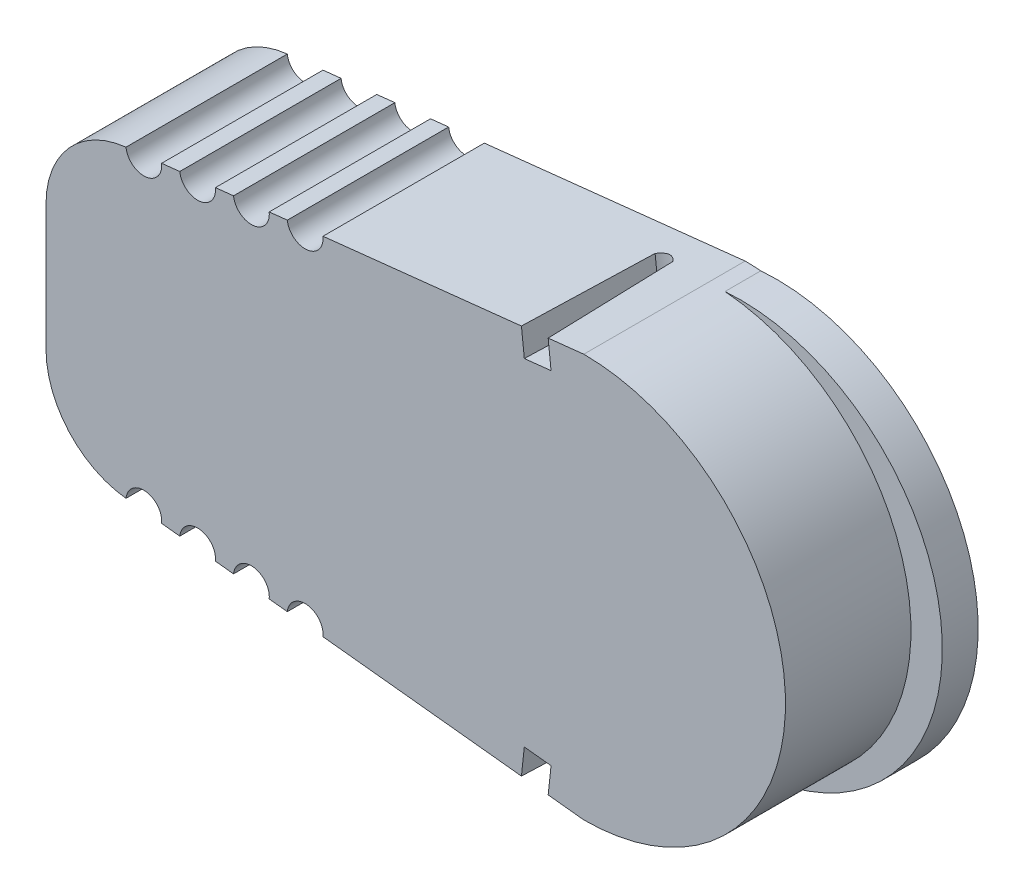
from build123d import *

# Parameters (mm, degrees)
SENSOR_HEIGHT_DEPTH               = 9
SENSOR_LIP_HEIGHT_DEPTH           = 2
SHORT_SIDE_EDGE_ROUNDING_R        = 5
SENSOR_HOLES_R                    = 1
EXTRUDED_SENSOR_HOLES_DEPTH       = 26.880736079
BOTTOM_TRIANGLE_CUT_DEPTH         = 1.5
TOP_TRIANGLE_CUT_DEPTH            = 1.5
FILAMENT_HOLE_CUT_DEPTH           = 2.5
FILAMENT_PROFILE_R                = 0.175
SENSING_START                     = -2
SENSING_FILAMENT_R                = 0.175
SENSING_FILAMENT_R_2              = 0.15
SENSING_PORTION_OF_FILAMENT_DEPTH = 2


# Read off the part's stored shape, not the designer's step: Sensor Lip Height
with BuildPart() as part:
    # Basic Sensor Dimensions → Sensor Height (new body)
    with BuildSketch(Plane.XY):
        with BuildLine():
            Line((-21.5, 8), (-21.5, -8))
            Line((-21.5, -8), (8.5, -11.25))
            ThreePointArc((8.5, -11.25), (19.75, 0), (8.5, 11.25))
            Line((8.5, 11.25), (-21.5, 8))
        make_face()
    extrude(amount=SENSOR_HEIGHT_DEPTH)

    # Sensor Lip Height outline → Sensor Lip Height (add)
    with BuildSketch(Plane.XY):
        with BuildLine():
            ThreePointArc((9.375, -11.215920604), (21.5, 0), (9.375, 11.215920604))
            ThreePointArc((9.375, 11.215920604), (19.75, 0), (9.375, -11.215920604))
        make_face()
    extrude(amount=SENSOR_LIP_HEIGHT_DEPTH)

    # Short Side Edge Rounding
    short_side_edge_rounding_edges = [part.edges().sort_by_distance(p)[0] for p in [
        (-21.5, -8, 4.5),
        (-21.5, 8, 4.5),
    ]]
    fillet(short_side_edge_rounding_edges, radius=SHORT_SIDE_EDGE_ROUNDING_R)

    # Sensor Holes → Extruded Sensor Holes (cut, through all)
    with BuildSketch(Plane.XY.offset(9)):
        with Locations((-16.044332748, -8.591030619)):
            Circle(SENSOR_HOLES_R)
        with Locations((-13.044332748, -8.916030619)):
            Circle(SENSOR_HOLES_R)
        with Locations((-10.044332748, -9.241030619)):
            Circle(SENSOR_HOLES_R)
        with Locations((-7.044332748, -9.566030619)):
            Circle(SENSOR_HOLES_R)
        with Locations((-10.044332748, 9.241030619)):
            Circle(SENSOR_HOLES_R)
        with Locations((-7.044332748, 9.566030619)):
            Circle(SENSOR_HOLES_R)
        with Locations((-13.044332748, 8.916030619)):
            Circle(SENSOR_HOLES_R)
        with Locations((-16.044332748, 8.591030619)):
            Circle(SENSOR_HOLES_R)
    extrude(amount=-EXTRUDED_SENSOR_HOLES_DEPTH, mode=Mode.SUBTRACT)

    # Bottom Triangle → Bottom Triangle Cut (cut)
    with BuildSketch(Plane(origin=(-1.106012767, -10.209348617, 0), x_dir=(0.9941830955390242, -0.10770316868339427, 0), z_dir=(-0.10770316868339427, -0.9941830955390242, 0))):
        with BuildLine():
            Line((6.91221696, 1.5), (6.91221696, 9))
            Line((6.91221696, 9), (6.16221696, 9))
            Line((6.16221696, 9), (6.41221696, 1.790726708))
            add(Edge.make_bspline(
                [(6.41221696, 1.790726708), (6.66221696, 1.5), (6.91221696, 1.5)],
                knots=[0, 0, 0, 0.5, 0.5, 0.5], degree=2))
        make_face()
        with BuildLine():
            Line((7.41221696, 1.790726708), (7.66221696, 9))
            Line((7.66221696, 9), (6.91221696, 9))
            Line((6.91221696, 9), (6.91221696, 1.5))
            add(Edge.make_bspline(
                [(6.91221696, 1.5), (7.16221696, 1.5), (7.41221696, 1.790726708)],
                knots=[0.5, 0.5, 0.5, 1, 1, 1], degree=2))
        make_face()
    extrude(amount=-BOTTOM_TRIANGLE_CUT_DEPTH, mode=Mode.SUBTRACT)

    # Top Triangle → Top Triangle Cut (cut)
    with BuildSketch(Plane(origin=(-1.106012767, 10.209348617, 0), x_dir=(0.9941830955390242, 0.10770316868339432, 0), z_dir=(-0.10770316868339432, 0.9941830955390242, 0))):
        with BuildLine():
            Line((6.91221696, -9), (7.66221696, -9))
            Line((7.66221696, -9), (7.41221696, -1.790726708))
            add(Edge.make_bspline(
                [(6.91221696, -1.5), (7.16221696, -1.5), (7.41221696, -1.790726708)],
                knots=[0.5, 0.5, 0.5, 1, 1, 1], degree=2))
            Line((6.91221696, -1.5), (6.91221696, -9))
        make_face()
        with BuildLine():
            Line((6.16221696, -9), (6.91221696, -9))
            Line((6.91221696, -9), (6.91221696, -1.5))
            add(Edge.make_bspline(
                [(6.41221696, -1.790726708), (6.66221696, -1.5), (6.91221696, -1.5)],
                knots=[0, 0, 0, 0.5, 0.5, 0.5], degree=2))
            Line((6.41221696, -1.790726708), (6.16221696, -9))
        make_face()
    extrude(amount=-TOP_TRIANGLE_CUT_DEPTH, mode=Mode.SUBTRACT)

    # Filament Hole → Filament Hole Cut (cut)
    with BuildSketch(Plane(origin=(0, 0, 0), x_dir=(-1, 0, 0), z_dir=(0, 0, -1))):
        with BuildLine():
            Line((4.5, 1), (1.5, 1))
            Line((1.5, 1), (1.5, -1))
            Line((1.5, -1), (4.5, -1))
            ThreePointArc((4.5, -1), (5.5, 0), (4.5, 1))
        make_face()
    extrude(amount=-FILAMENT_HOLE_CUT_DEPTH, mode=Mode.SUBTRACT)

    # Filament: sweep along a curve in space
    with BuildLine() as filament_path:
        Line((-3.5, 0, 0), (-3.5, 0, 2.5))
        Line((-3.5, 0, 0), (5.692388155, 0, -9.192388155))
    # Filament profile (on start of the path) → Filament (sweep)
    with BuildSketch(Plane(origin=(5.692388155, 0, -9.192388155), x_dir=(0.7071067811865488, 0, 0.7071067811865464), z_dir=(-0.7071067811865464, 0, 0.7071067811865488))):
        Circle(FILAMENT_PROFILE_R)
    sweep(path=filament_path.line, transition=Transition.RIGHT)

    # Sensing Filament → Sensing Portion of Filament (cut)
    with BuildSketch(Plane(origin=(7.442388155, 0, -7.442388155), x_dir=(-0.7071067811865488, 0, -0.7071067811865462), z_dir=(0.7071067811865462, 0, -0.7071067811865488)).offset(SENSING_START)):
        with Locations((2.474873734, 0)):
            Circle(SENSING_FILAMENT_R)
        with Locations((2.474873734, 0)):
            Circle(SENSING_FILAMENT_R_2, mode=Mode.SUBTRACT)
    extrude(amount=SENSING_PORTION_OF_FILAMENT_DEPTH, mode=Mode.SUBTRACT)


solid = part.part
